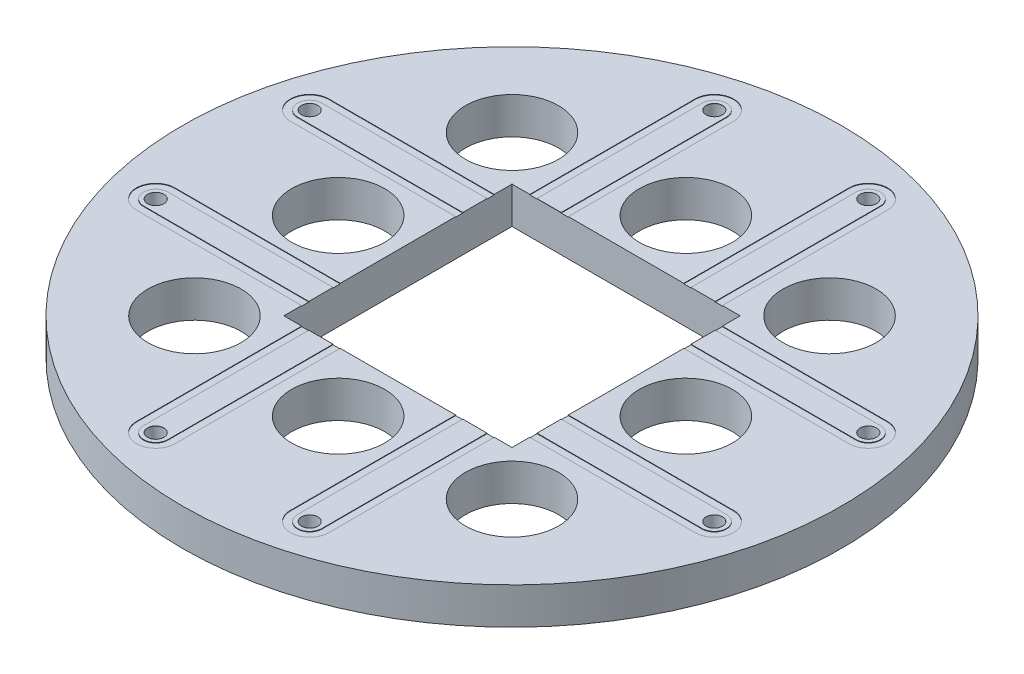
from build123d import *

# Parameters (mm, degrees)
BODAY_SKETCH_R    = 11.557
BODY_DEPTH        = 1.27
COPPER_START      = 0.017500092
COPPER_SKETCH_R   = 11.557
COPPER_DEPTH      = 0.017500092
GAP_CUT_DEPTH     = 17.39333395
CENTER_DEPTH      = 0.017500092
IO_HOLE_SKETCH_R  = 0.287000061
IO_HOLE_DEPTH     = 17.39333395
GAP_CUTS_COUNT    = 4
CENTERS_COUNT     = 4
IO_HOLES_COUNT    = 4
POCKET_DEPTH      = 17.39333395
POCKET_DEPTH_BACK = 17.39333395
POCKET_SKETCH_W   = 8.000000002
POCKET_SKETCH_H   = 8.000000002
POSTS_R           = 1.63195
POST_CUT_DEPTH    = 17.39333395
POST_CUTS_COUNT   = 4


with BuildPart() as part:
    # Boday Sketch → Body (new body)
    with BuildSketch(Plane(origin=(0, 0, 0), x_dir=(1, 0, 0), z_dir=(0, 1, 0))):
        Circle(BODAY_SKETCH_R)
    extrude(amount=-BODY_DEPTH)

    # Copper Sketch → Copper (add)
    with BuildSketch(Plane(origin=(0, 0, 0), x_dir=(1, 0, 0), z_dir=(0, 1, 0)).offset(COPPER_START)):
        Circle(COPPER_SKETCH_R)
    extrude(amount=-COPPER_DEPTH)

    # Gap → Gap Cut (cut, through all)
    with BuildSketch(Plane(origin=(0, 0, 0), x_dir=(1, 0, 0), z_dir=(0, 1, 0))):
        with BuildLine():
            Line((-3.374999981, 9.794672039), (-3.374999981, -9.794672039))
            ThreePointArc((-3.374999981, -9.794672039), (-2.699999934, -10.469672086), (-2.024999887, -9.794672039))
            Line((-2.024999887, -9.794672039), (-2.024999887, 9.794672039))
            ThreePointArc((-2.024999887, 9.794672039), (-2.699999934, 10.469672086), (-3.374999981, 9.794672039))
        make_face()
    gap_cut = extrude(amount=GAP_CUT_DEPTH, mode=Mode.SUBTRACT)


with BuildPart() as body_2:
    # Center Sketch → Center (new body)
    with BuildSketch(Plane(origin=(0, 0, 0), x_dir=(1, 0, 0), z_dir=(0, 1, 0))):
        with BuildLine():
            Line((-3.124999973, 9.794672039), (-3.124999973, -9.794672039))
            ThreePointArc((-3.124999973, -9.794672039), (-2.699999934, -10.219672078), (-2.274999895, -9.794672039))
            Line((-2.274999895, -9.794672039), (-2.274999895, 9.794672039))
            ThreePointArc((-2.274999895, 9.794672039), (-2.699999934, 10.219672078), (-3.124999973, 9.794672039))
        make_face()
    center = extrude(amount=CENTER_DEPTH)


with BuildPart() as io_hole_tool:
    # IO Hole Sketch → IO Hole (new, symmetric)
    with BuildSketch(Plane(origin=(0, 0, 0), x_dir=(1, 0, 0), z_dir=(0, 1, 0))):
        with Locations((-2.699999934, 9.794672039)):
            Circle(IO_HOLE_SKETCH_R)
        with Locations((-2.699999934, -9.794672039)):
            Circle(IO_HOLE_SKETCH_R)
    io_hole = extrude(amount=IO_HOLE_DEPTH, both=True)


with BuildPart() as part_1:
    add(part.part)

    # IO Hole: cut by io_hole_tool
    add(io_hole_tool.part, mode=Mode.SUBTRACT)

    # Gap Cuts: Gap Cut ×4 about axis
    gap_cuts_axis = Axis((0, 0.0762, 0), (0, -1, 0))
    for i in range(1, GAP_CUTS_COUNT):
        add(gap_cut.rotate(gap_cuts_axis, i * 360 / GAP_CUTS_COUNT), mode=Mode.SUBTRACT)

    # Centers: Center ×4 about axis
    centers_axis = Axis((0, 0.0762, 0), (0, -1, 0))
    for i in range(1, CENTERS_COUNT):
        add(center.rotate(centers_axis, i * 360 / CENTERS_COUNT))

    # IO Holes: IO Hole ×4 about axis
    io_holes_axis = Axis((0, 0.0762, 0), (0, -1, 0))
    for i in range(1, IO_HOLES_COUNT):
        add(io_hole.rotate(io_holes_axis, i * 360 / IO_HOLES_COUNT), mode=Mode.SUBTRACT)


with BuildPart() as body_2_1:
    add(body_2.part)

    # IO Hole: cut by io_hole_tool
    add(io_hole_tool.part, mode=Mode.SUBTRACT)


with BuildPart() as pocket_tool:
    # Pocket Sketch → Pocket (new, two sides: drawn at the far end of the back side and taken through both)
    with BuildSketch(Plane(origin=(0, 0, 0), x_dir=(1, 0, 0), z_dir=(0, 1, 0)).offset(-POCKET_DEPTH_BACK)):
        Rectangle(POCKET_SKETCH_W, POCKET_SKETCH_H)
    extrude(amount=POCKET_DEPTH + POCKET_DEPTH_BACK)


with BuildPart() as part_2:
    add(part_1.part)

    # Pocket: cut by pocket_tool
    add(pocket_tool.part, mode=Mode.SUBTRACT)

    # Posts → Post Cut (cut, symmetric)
    with BuildSketch(Plane(origin=(0, 0, 0), x_dir=(1, 0, 0), z_dir=(0, 1, 0))):
        with Locations((0, 6.096)):
            Circle(POSTS_R)
        with Locations((-5.567758795, 5.567758795)):
            Circle(POSTS_R)
    post_cut = extrude(amount=POST_CUT_DEPTH, both=True, mode=Mode.SUBTRACT)

    # Post Cuts: Post Cut ×4 about axis
    post_cuts_axis = Axis((0, 0.0762, 0), (0, -1, 0))
    for i in range(1, POST_CUTS_COUNT):
        add(post_cut.rotate(post_cuts_axis, i * 360 / POST_CUTS_COUNT), mode=Mode.SUBTRACT)


with BuildPart() as body_2_2:
    add(body_2_1.part)

    # Pocket: cut by pocket_tool
    add(pocket_tool.part, mode=Mode.SUBTRACT)


solid = Compound([part_2.part, body_2_2.part])
